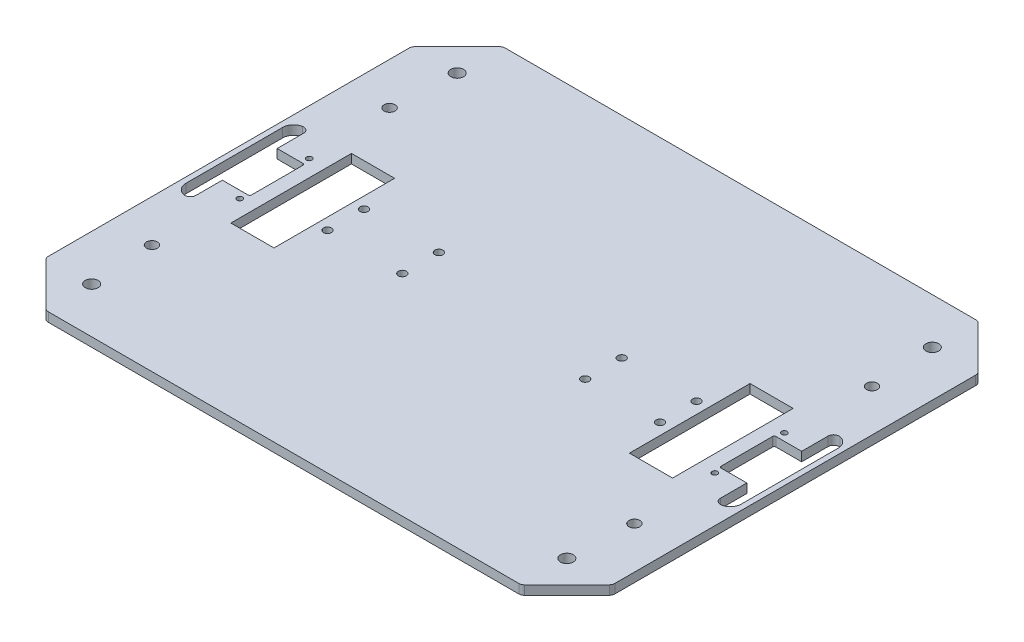
from build123d import *

# Parameters (mm, degrees)
BOSS_EXTRU_1_DEPTH         = 5
CONG_1_R                   = 3
ESQUISSE2_R                = 3
PER_AGE_PROFIL_DEPTH       = 200.18584287
ESQUISSE3_R                = 1.5
PER_AGE_ENCODEUR_DEPTH     = 200.18584287
POCHE_ROUE_ENCODEUSE_DEPTH = 200.18584287
CONG_2_R                   = 6
CONG_3_R                   = 3
ESQUISSE5_R                = 2.2
PER_AGE_BLOC_MOTEUR_DEPTH  = 200.185843014
ESQUISSE6_W                = 23.6
ESQUISSE6_H                = 66
POCHE_ROUE_MOTRICE_DEPTH   = 200.185843014
ESQUISSE7_R                = 3.5
PER_AGE_PATIN_DEPTH        = 200.185843014


with BuildPart() as part:
    # Esquisse1 → Boss.-Extru.1 (new body)
    with BuildSketch(Plane(origin=(0, 0, 0), x_dir=(1, 0, 0), z_dir=(0, 1, 0))):
        Polygon((-130, 125), (130, 125), (155, 100), (155, -100), (130, -125), (-130, -125), (-155, -100), (-155, 100), align=None)
    extrude(amount=BOSS_EXTRU_1_DEPTH)

    # Congé1
    cong_1_edges = [part.edges().sort_by_distance(p)[0] for p in [
        (-155, 2.5, 100),
        (-130, 2.5, 125),
        (130, 2.5, 125),
        (155, 2.5, 100),
        (155, 2.5, -100),
        (130, 2.5, -125),
        (-130, 2.5, -125),
        (-155, 2.5, -100),
    ]]
    fillet(cong_1_edges, radius=CONG_1_R)

    # Esquisse2 → Perçage Profilé (cut, through all)
    with BuildSketch(Plane(origin=(0, 5, 0), x_dir=(1, 0, 0), z_dir=(0, 1, 0))):
        with Locations((-132, -65)):
            Circle(ESQUISSE2_R)
        with Locations((-132, 65)):
            Circle(ESQUISSE2_R)
        with Locations((132, -65)):
            Circle(ESQUISSE2_R)
        with Locations((132, 65)):
            Circle(ESQUISSE2_R)
    extrude(amount=-PER_AGE_PROFIL_DEPTH, mode=Mode.SUBTRACT)

    # Esquisse3 → Perçage Encodeur (cut, through all)
    with BuildSketch(Plane(origin=(0, 5, 0), x_dir=(1, 0, 0), z_dir=(0, 1, 0))):
        with Locations((-130, 19)):
            Circle(ESQUISSE3_R)
        with Locations((-130, -19)):
            Circle(ESQUISSE3_R)
        with Locations((130, -19)):
            Circle(ESQUISSE3_R)
        with Locations((130, 19)):
            Circle(ESQUISSE3_R)
    extrude(amount=-PER_AGE_ENCODEUR_DEPTH, mode=Mode.SUBTRACT)

    # Esquisse4 → Poche Roue Encodeuse (cut, through all)
    with BuildSketch(Plane(origin=(0, 5, 0), x_dir=(1, 0, 0), z_dir=(0, 1, 0))):
        with BuildLine():
            Line((143.5, -15), (129.5, -15))
            ThreePointArc((129.5, -15), (128.792893219, -14.707106781), (128.5, -14))
            Line((128.5, -14), (128.5, 14))
            ThreePointArc((128.5, 14), (128.792893219, 14.707106781), (129.5, 15))
            Line((129.5, 15), (143.5, 15))
            Line((143.5, 15), (143.5, 32.5))
            Line((143.5, 32.5), (152, 32.5))
            Line((152, 32.5), (152, -32.5))
            Line((152, -32.5), (143.5, -32.5))
            Line((143.5, -32.5), (143.5, -15))
        make_face()
        with BuildLine():
            Line((-128.5, -14), (-128.5, 14))
            ThreePointArc((-128.5, 14), (-128.792893219, 14.707106781), (-129.5, 15))
            Line((-129.5, 15), (-143.5, 15))
            Line((-143.5, 15), (-143.5, 32.5))
            Line((-143.5, 32.5), (-152, 32.5))
            Line((-152, 32.5), (-152, -32.5))
            Line((-152, -32.5), (-143.5, -32.5))
            Line((-143.5, -32.5), (-143.5, -15))
            Line((-143.5, -15), (-129.5, -15))
            ThreePointArc((-129.5, -15), (-128.792893219, -14.707106781), (-128.5, -14))
        make_face()
    extrude(amount=-POCHE_ROUE_ENCODEUSE_DEPTH, mode=Mode.SUBTRACT)

    # Congé2
    cong_2_edges = [part.edges().sort_by_distance(p)[0] for p in [
        (152, 2.5, 32.5),
        (152, 2.5, -32.5),
        (-152, 2.5, 32.5),
        (-152, 2.5, -32.5),
    ]]
    fillet(cong_2_edges, radius=CONG_2_R)

    # Congé3
    cong_3_edges = [part.edges().sort_by_distance(p)[0] for p in [
        (143.5, 2.5, 32.5),
        (143.5, 2.5, -32.5),
        (-143.5, 2.5, 32.5),
        (-143.5, 2.5, -32.5),
    ]]
    fillet(cong_3_edges, radius=CONG_3_R)

    # Esquisse5 → Perçage Bloc Moteur (cut, through all)
    with BuildSketch(Plane(origin=(0, 5, 0), x_dir=(1, 0, 0), z_dir=(0, 1, 0))):
        with Locations((-91, 10)):
            Circle(ESQUISSE5_R)
        with Locations((-91, -10)):
            Circle(ESQUISSE5_R)
        with Locations((-50, -10)):
            Circle(ESQUISSE5_R)
        with Locations((-50, 10)):
            Circle(ESQUISSE5_R)
        with Locations((50, 10)):
            Circle(ESQUISSE5_R)
        with Locations((50, -10)):
            Circle(ESQUISSE5_R)
        with Locations((91, -10)):
            Circle(ESQUISSE5_R)
        with Locations((91, 10)):
            Circle(ESQUISSE5_R)
    extrude(amount=-PER_AGE_BLOC_MOTEUR_DEPTH, mode=Mode.SUBTRACT)

    # Esquisse6 → Poche Roue Motrice (cut, through all)
    with BuildSketch(Plane(origin=(0, 5, 0), x_dir=(1, 0, 0), z_dir=(0, 1, 0))):
        with Locations((-109.05, 0)):
            Rectangle(ESQUISSE6_W, ESQUISSE6_H)
        with Locations((109.05, 0)):
            Rectangle(ESQUISSE6_W, ESQUISSE6_H)
    extrude(amount=-POCHE_ROUE_MOTRICE_DEPTH, mode=Mode.SUBTRACT)

    # Esquisse7 → Perçage Patin (cut, through all)
    with BuildSketch(Plane(origin=(0, 5, 0), x_dir=(1, 0, 0), z_dir=(0, 1, 0))):
        with Locations((-130, 100)):
            Circle(ESQUISSE7_R)
        with Locations((-130, -100)):
            Circle(ESQUISSE7_R)
        with Locations((130, -100)):
            Circle(ESQUISSE7_R)
        with Locations((130, 100)):
            Circle(ESQUISSE7_R)
    extrude(amount=-PER_AGE_PATIN_DEPTH, mode=Mode.SUBTRACT)


solid = part.part
